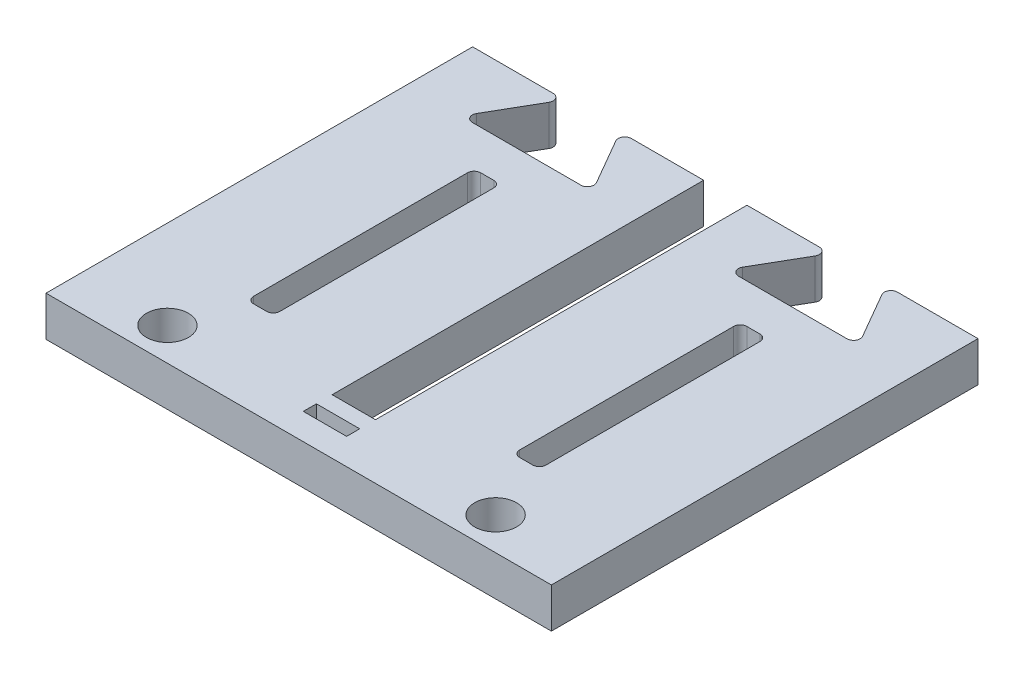
from build123d import *

# Parameters (mm, degrees)
BOSS_EXTRUDE1_DEPTH                = 3.05
FILLET3_R                          = 0.5
SKETCH2_W                          = 3.3
SKETCH2_H                          = 61.8
SKETCH2_H_2                        = 1
CUT_EXTRUDE1_DEPTH                 = 38.89610798
SKETCH6_W                          = 2
SKETCH6_H                          = 17.3
CUT_EXTRUDE2_DEPTH                 = 38.89610798
FILLET4_R                          = 0.5
M3_CLEARANCE_HEAD_MOUNTING_HOLES_D = 3.2


with BuildPart() as part:
    # Sketch1 → Boss-Extrude1 (new body)
    with BuildSketch(Plane(origin=(0, 0, 0), x_dir=(1, 0, 0), z_dir=(0, 1, 0))):
        Polygon((-19.25, 0), (-19.25, 32.5), (-12.25, 32.5), (-15.136751346, 27.5), (-5.136751346, 27.5), (-8.023502692, 32.5), (8.023502692, 32.5), (5.136751346, 27.5), (15.136751346, 27.5), (12.25, 32.5), (19.25, 32.5), (19.25, 0), align=None)
    extrude(amount=BOSS_EXTRUDE1_DEPTH)

    # Fillet3
    fillet3_edges = [part.edges().sort_by_distance(p)[0] for p in [
        (15.136751346, 1.525, -27.5),
        (12.25, 1.525, -32.5),
        (5.136751346, 1.525, -27.5),
        (8.023502692, 1.525, -32.5),
        (-8.023502692, 1.525, -32.5),
        (-5.136751346, 1.525, -27.5),
        (-15.136751346, 1.525, -27.5),
        (-12.25, 1.525, -32.5),
    ]]
    fillet(fillet3_edges, radius=FILLET3_R)

    # Sketch2 → Cut-Extrude1 (cut, through all)
    with BuildSketch(Plane(origin=(0, 3.05, 0), x_dir=(1, 0, 0), z_dir=(0, 1, 0))):
        with Locations((0, 35.1)):
            Rectangle(SKETCH2_W, SKETCH2_H)
        with Locations((0, 2.5)):
            Rectangle(SKETCH2_W, SKETCH2_H_2)
    extrude(amount=-CUT_EXTRUDE1_DEPTH, mode=Mode.SUBTRACT)

    # Sketch6 → Cut-Extrude2 (cut, through all)
    with BuildSketch(Plane(origin=(0, 3.05, 0), x_dir=(1, 0, 0), z_dir=(0, 1, 0))):
        with Locations((-10.136751346, 15.85)):
            Rectangle(SKETCH6_W, SKETCH6_H)
        with Locations((10.136751346, 15.85)):
            Rectangle(SKETCH6_W, SKETCH6_H)
    extrude(amount=-CUT_EXTRUDE2_DEPTH, mode=Mode.SUBTRACT)

    # Fillet4
    fillet4_edges = [part.edges().sort_by_distance(p)[0] for p in [
        (9.136751346, 1.525, -7.2),
        (11.136751346, 1.525, -7.2),
        (11.136751346, 1.525, -24.5),
        (9.136751346, 1.525, -24.5),
        (-11.136751346, 1.525, -7.2),
        (-9.136751346, 1.525, -7.2),
        (-9.136751346, 1.525, -24.5),
        (-11.136751346, 1.525, -24.5),
    ]]
    fillet(fillet4_edges, radius=FILLET4_R)

    # M3 Clearance Head Mounting Holes (through all)
    with Locations(Plane(origin=(0, 3.05, 0), x_dir=(1, 0, 0), z_dir=(0, 1, 0))):
        with Locations((-12.5, 2.5), (12.5, 2.5)):
            Hole(M3_CLEARANCE_HEAD_MOUNTING_HOLES_D / 2)


solid = part.part
